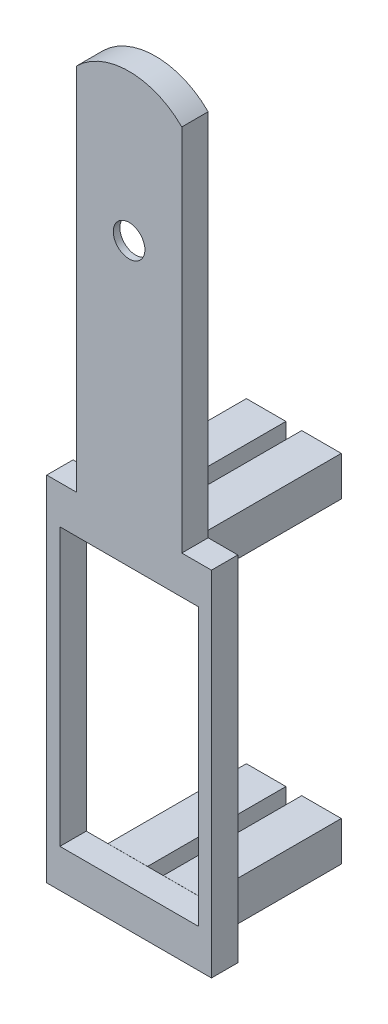
from build123d import *

# Parameters (mm, degrees)
EXTRUDE_1_DEPTH          = 4
CUT_EXTRUDE_2_DEPTH      = 3
CUT_EXTRUDE_5_DEPTH      = 4
CUT_EXTRUDE_5_DEPTH_BACK = 2
SKETCH_5_R               = 2.4
SKETCH_2_W               = 21
SKETCH_2_H               = 42
CUT_EXTRUDE_6_DEPTH      = 4
SKETCH_6_W               = 6
SKETCH_6_H               = 6
EXTRUDE_2_DEPTH          = 21
SKETCH_3_R               = 1.15
CUT_EXTRUDE_7_DEPTH      = 21


with BuildPart() as part:
    # 草圖1 → 填料-伸長1 (new body)
    with BuildSketch(Plane.XY):
        with BuildLine():
            Line((-12.5, 26.8), (-12.5, -26.8))
            Line((-12.5, -26.8), (12.5, -26.8))
            Line((12.5, -26.8), (12.5, 26.8))
            Line((12.5, 26.8), (8, 26.8))
            Line((8, 26.8), (8, 82.8))
            ThreePointArc((8, 82.8), (0, 86.113708499), (-8, 82.8))
            Line((-8, 82.8), (-8, 26.8))
            Line((-8, 26.8), (-12.5, 26.8))
        make_face()
    extrude(amount=EXTRUDE_1_DEPTH)

    # 草圖4 → 除料-伸長2 (cut)
    with BuildSketch(Plane.XY):
        with BuildLine():
            Line((-2.6, 81.8), (-5, 68.00724828))
            ThreePointArc((-5, 68.00724828), (-6.469116128, 64.4868159), (-5.710139073, 60.748407125))
            Line((-5.710139073, 60.748407125), (-2.6, 47.098241011))
            ThreePointArc((-2.6, 47.098241011), (0, 44.498241011), (2.6, 47.098241011))
            Line((2.6, 47.098241011), (5.710139073, 60.748407125))
            ThreePointArc((5.710139073, 60.748407125), (6.469116128, 64.4868159), (5, 68.00724828))
            Line((5, 68.00724828), (2.6, 81.8))
            ThreePointArc((2.6, 81.8), (0, 84.4), (-2.6, 81.8))
        make_face()
    extrude(amount=CUT_EXTRUDE_2_DEPTH, mode=Mode.SUBTRACT)

    # 草圖5 → 除料-伸長5 (cut, two sides: drawn at the far end of the back side and taken through both)
    with BuildSketch(Plane.XY.offset(-CUT_EXTRUDE_5_DEPTH_BACK)):
        with Locations((0, 63.853936349)):
            Circle(SKETCH_5_R)
    extrude(amount=CUT_EXTRUDE_5_DEPTH + CUT_EXTRUDE_5_DEPTH_BACK, mode=Mode.SUBTRACT)

    # 草圖2 → 除料-伸長6 (cut)
    with BuildSketch(Plane.XY):
        Rectangle(SKETCH_2_W, SKETCH_2_H)
    extrude(amount=CUT_EXTRUDE_6_DEPTH, mode=Mode.SUBTRACT)

    # 草圖6 → 填料-伸長2 (add)
    with BuildSketch(Plane.XY):
        with Locations((-4.2, 24)):
            Rectangle(SKETCH_6_W, SKETCH_6_H)
        with Locations((4.2, -23.985077759)):
            Rectangle(SKETCH_6_W, SKETCH_6_H)
        with Locations((-4.2, -23.985077759)):
            Rectangle(SKETCH_6_W, SKETCH_6_H)
        with Locations((4.2, 24)):
            Rectangle(SKETCH_6_W, SKETCH_6_H)
    extrude(amount=-EXTRUDE_2_DEPTH)

    # 草圖3 → 除料-伸長7 (cut)
    with BuildSketch(Plane.XY):
        with Locations((-4.7, 23.81)):
            Circle(SKETCH_3_R)
        with Locations((4.7, 23.81)):
            Circle(SKETCH_3_R)
        with Locations((4.7, -23.81)):
            Circle(SKETCH_3_R)
        with Locations((-4.7, -23.81)):
            Circle(SKETCH_3_R)
    extrude(amount=-CUT_EXTRUDE_7_DEPTH, mode=Mode.SUBTRACT)


solid = part.part
